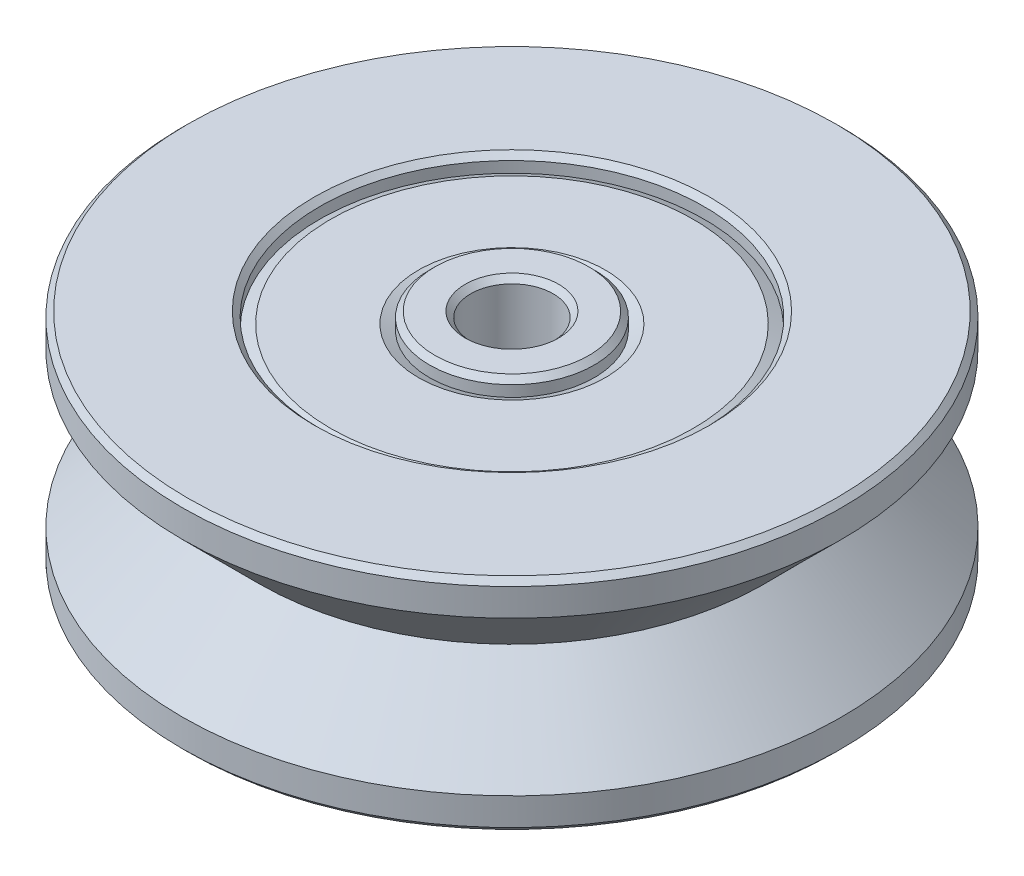
from build123d import *

# Parameters (mm, degrees)
CHAMFER1_SIZE = 0.1


with BuildPart() as part:
    # Sketch1 → Revolve1 (revolve)
    with BuildSketch(Plane(origin=(0, 0, 0), x_dir=(0, 0, -1), z_dir=(1, 0, 0))):
        Polygon((4.6, 0), (6, 1.4), (6, 2), (0.75, 2), (0.75, -2), (6, -2), (6, -1.4), align=None)
    revolve(axis=Axis((0, 2, 0), (0, -1, 0)))

    # Sketch3 → Cut-Revolve2 (revolve, cut)
    with BuildSketch(Plane(origin=(0, 0, 0), x_dir=(0, 0, -1), z_dir=(1, 0, 0))):
        Polygon((3.5, 2), (1.5, 2), (1.5, 1.7), (1.7, 1.8), (3.3, 1.8), (3.5, 1.7), align=None)
    cut_revolve2 = revolve(axis=Axis((0, 2, 0), (0, -1, 0)), mode=Mode.SUBTRACT)

    # Mirror1: Cut-Revolve2 across plane
    add(cut_revolve2.mirror(Plane.ZX), mode=Mode.SUBTRACT)

    # Chamfer1
    chamfer1_edges = [part.edges().sort_by_distance(p)[0] for p in [
        (0, -2, 3.5),
        (0, 2, 3.5),
        (0, -2, 6),
        (0, 2, 6),
        (0, -2, 1.5),
        (0, 2, 1.5),
        (0, 2, 0.75),
        (0, -2, 0.75),
    ]]
    chamfer(chamfer1_edges, length=CHAMFER1_SIZE)


solid = part.part
